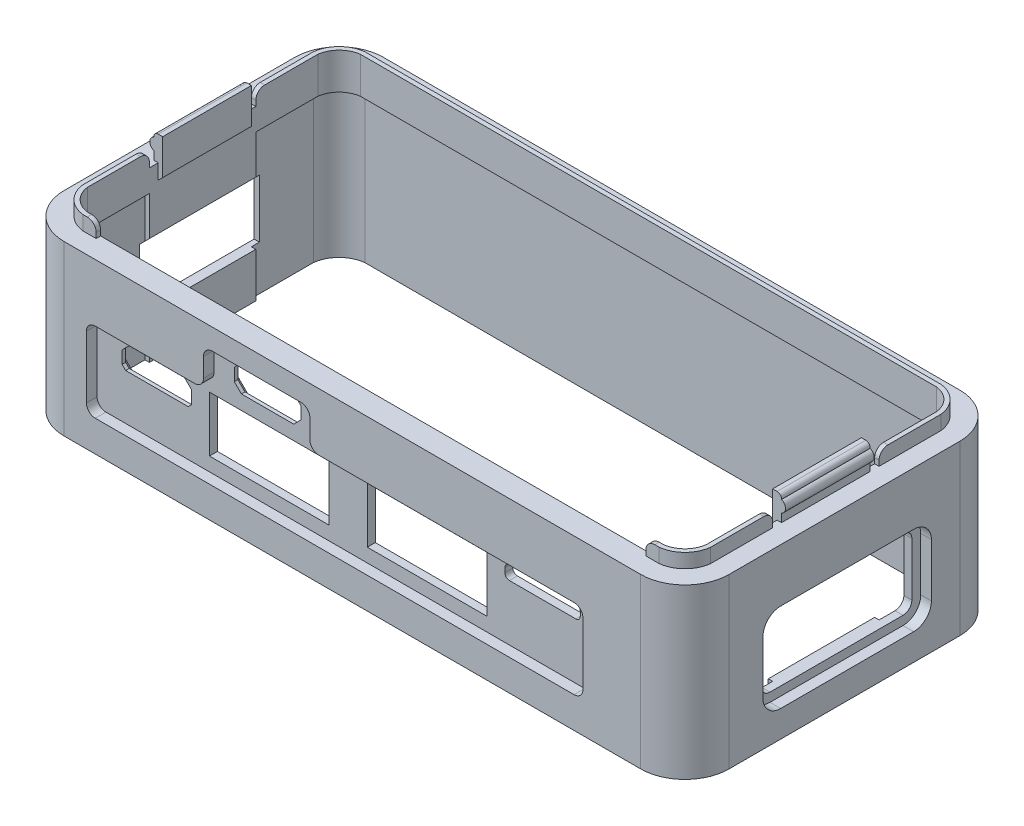
from build123d import *

# Parameters (mm, degrees)
EXTRUDE_2_DEPTH      = 19
EXTRUDE_4_DEPTH      = 1.6
CUT_EXTRUDE_START    = -19
CUT_EXTRUDE_2_DEPTH  = 19
SKETCH_17_W          = 13.5
SKETCH_17_H          = 6.25
SKETCH_17_W_2        = 7.85
SKETCH_17_H_2        = 2.62
SKETCH_17_W_3        = 7.5
CUT_EXTRUDE_4_DEPTH  = 2.62
CUT_EXTRUDE_5_REACH  = 81.833
SKETCH_18_W          = 13.5
SKETCH_18_H          = 6.25
CUT_EXTRUDE_6_REACH  = 81.833
SKETCH_19_W          = 17
SKETCH_19_H          = 8
CHAMFER_1_SIZE       = 0.4
CHAMFER_2_SIZE       = 0.8
SKETCH_21_W          = 56
SKETCH_21_H          = 9
CUT_EXTRUDE_8_DEPTH  = 1.2
SKETCH_22_W          = 12
SKETCH_22_H          = 4.148134673
CUT_EXTRUDE_9_DEPTH  = 1.2
SKETCH_23_W          = 19
SKETCH_23_H          = 10
CUT_EXTRUDE_10_DEPTH = 1.5
FILLET_2_R           = 1
CUT_EXTRUDE_11_DEPTH = 1.2
SKETCH_25_W          = 62
SKETCH_25_H          = 0.5
CUT_EXTRUDE_12_DEPTH = 1.6
FILLET_3_R           = 1
SKETCH_26_W          = 0.5
SKETCH_26_H          = 10
EXTRUDE_5_DEPTH      = 1.2
SKETCH_27_R          = 0.7
EXTRUDE_6_DEPTH      = 10
SKETCH_28_W          = 0.5
SKETCH_28_H          = 1
CUT_EXTRUDE_13_DEPTH = 1.6
FILLET_4_R           = 1
SKETCH_29_W          = 10
SKETCH_29_H          = 5
EXTRUDE_7_DEPTH      = 0.5
SKETCH_30_W          = 10
SKETCH_30_H          = 5
EXTRUDE_8_DEPTH      = 0.5
FILLET_5_R           = 0.5
CHAMFER_3_SIZE       = 1
CUT_EXTRUDE_14_REACH = 59.407
SKETCH_32_W          = 8.5
SKETCH_32_H          = 1.5
FILLET_6_R           = 0.5
CUT_EXTRUDE_18_DEPTH = 16.5
CHAMFER_5_SIZE       = 0.5
CHAMFER_6_SIZE       = 0.8


with BuildPart() as part:
    # case 2 → 凸台-拉伸2 (new body)
    with BuildSketch(Plane(origin=(0, 0, 0), x_dir=(1, 0, 0), z_dir=(0, 1, 0))):
        with BuildLine():
            Line((-34.042196447, 18), (30.957803553, 18))
            ThreePointArc((30.957803553, 18), (34.493337459, 16.535533906), (35.957803553, 13))
            Line((35.957803553, 13), (35.957803553, -13))
            ThreePointArc((35.957803553, -13), (34.493337459, -16.535533906), (30.957803553, -18))
            Line((30.957803553, -18), (-34.042196447, -18))
            ThreePointArc((-34.042196447, -18), (-37.577730353, -16.535533906), (-39.042196447, -13))
            Line((-39.042196447, -13), (-39.042196447, 13))
            ThreePointArc((-39.042196447, 13), (-37.577730353, 16.535533906), (-34.042196447, 18))
        make_face()
    extrude(amount=EXTRUDE_2_DEPTH)

    # 草图3 → 凸台-拉伸4 (add)
    with BuildSketch(Plane(origin=(0, 19, 0), x_dir=(1, 0, 0), z_dir=(0, 1, 0))):
        with BuildLine():
            Line((-36.942196447, 13), (-36.942196447, -13))
            ThreePointArc((-36.942196447, -13), (-35.997398295, -14.955201848), (-34.042196447, -15.9))
            Line((-34.042196447, -15.9), (30.957803553, -15.9))
            ThreePointArc((30.957803553, -15.9), (32.913005401, -14.955201848), (33.857803553, -13))
            Line((33.857803553, -13), (33.857803553, 13))
            ThreePointArc((33.857803553, 13), (32.913005401, 14.955201848), (30.957803553, 15.9))
            Line((30.957803553, 15.9), (-34.042196447, 15.9))
            ThreePointArc((-34.042196447, 15.9), (-35.997398295, 14.955201848), (-36.942196447, 13))
        make_face()
        with BuildLine():
            Line((-34.042196447, -15.4), (30.957803553, -15.4))
            ThreePointArc((30.957803553, -15.4), (32.562900965, -14.605097413), (33.357803553, -13))
            Line((33.357803553, -13), (33.357803553, 13))
            ThreePointArc((33.357803553, 13), (32.562900965, 14.605097413), (30.957803553, 15.4))
            Line((30.957803553, 15.4), (-34.042196447, 15.4))
            ThreePointArc((-34.042196447, 15.4), (-35.64729386, 14.605097413), (-36.442196447, 13))
            Line((-36.442196447, 13), (-36.442196447, -13))
            ThreePointArc((-36.442196447, -13), (-35.64729386, -14.605097413), (-34.042196447, -15.4))
        make_face(mode=Mode.SUBTRACT)
    extrude(amount=EXTRUDE_4_DEPTH)

    # 草图14 → 切除-拉伸2 (cut)
    with BuildSketch(Plane(origin=(0, 19, 0), x_dir=(1, 0, 0), z_dir=(0, 1, 0)).offset(CUT_EXTRUDE_START)):
        with BuildLine():
            Line((-34.042196447, -15.4), (30.957803553, -15.4))
            ThreePointArc((30.957803553, -15.4), (32.562900965, -14.605097413), (33.357803553, -13))
            Line((33.357803553, -13), (33.357803553, 13))
            ThreePointArc((33.357803553, 13), (32.562900965, 14.605097413), (30.957803553, 15.4))
            Line((30.957803553, 15.4), (-34.042196447, 15.4))
            ThreePointArc((-34.042196447, 15.4), (-35.64729386, 14.605097413), (-36.442196447, 13))
            Line((-36.442196447, 13), (-36.442196447, -13))
            ThreePointArc((-36.442196447, -13), (-35.64729386, -14.605097413), (-34.042196447, -15.4))
        make_face()
    extrude(amount=CUT_EXTRUDE_2_DEPTH, mode=Mode.SUBTRACT)

    # 草图17 → 切除-拉伸4 (cut)
    with BuildSketch(Plane.XY.offset(18)):
        with Locations((5.685908513, 8.169304758)):
            Rectangle(SKETCH_17_W, SKETCH_17_H)
        with Locations((-12.114091487, 8.169304758)):
            Rectangle(SKETCH_17_W, SKETCH_17_H)
        with Locations((-24.789091487, 9.984304758)):
            Rectangle(SKETCH_17_W_2, SKETCH_17_H_2)
        with Locations((-12.314091487, 14.224304758)):
            Rectangle(SKETCH_17_W_3, SKETCH_17_H_2)
    extrude(amount=-CUT_EXTRUDE_4_DEPTH, mode=Mode.SUBTRACT)

    # 草图18 → 切除-拉伸5 (cut, up to next)
    with BuildSketch(Plane.ZY.offset(39.042196447), mode=Mode.PRIVATE) as cut_extrude_5_sk1:
        with Locations((-0.163773099, 8.169304758)):
            Rectangle(SKETCH_18_W, SKETCH_18_H)
    cut_extrude_5_tool1 = extrude(cut_extrude_5_sk1.sketch, amount=-CUT_EXTRUDE_5_REACH, mode=Mode.PRIVATE) & part.part
    add(cut_extrude_5_tool1.solids().sort_by_distance((-39.042196, 8.169305, -0.163773))[0], mode=Mode.SUBTRACT)

    # 草图19 → 切除-拉伸6 (cut, up to next)
    with BuildSketch(Plane(origin=(35.957803553, 0, 0), x_dir=(0, 0, -1), z_dir=(1, 0, 0)), mode=Mode.PRIVATE) as cut_extrude_6_sk1:
        with Locations((0.3, 8)):
            Rectangle(SKETCH_19_W, SKETCH_19_H)
    cut_extrude_6_tool1 = extrude(cut_extrude_6_sk1.sketch, amount=-CUT_EXTRUDE_6_REACH, mode=Mode.PRIVATE) & part.part
    add(cut_extrude_6_tool1.solids().sort_by_distance((35.957804, 8, -0.3))[0], mode=Mode.SUBTRACT)

    # 倒角1
    chamfer_1_edges = [part.edges().sort_by_distance(p)[0] for p in [
        (-20.864091487, 8.674304758, 16.7),
        (-28.714091487, 8.674304758, 16.7),
        (-8.564091487, 15.534304758, 16.7),
        (-16.064091487, 15.534304758, 16.7),
    ]]
    chamfer(chamfer_1_edges, length=CHAMFER_1_SIZE)

    # 倒角2
    chamfer_2_edges = [part.edges().sort_by_distance(p)[0] for p in [
        (-20.864091487, 11.294304758, 16.7),
        (-28.714091487, 11.294304758, 16.7),
        (-8.564091487, 12.914304758, 16.7),
        (-16.064091487, 12.914304758, 16.7),
    ]]
    chamfer(chamfer_2_edges, length=CHAMFER_2_SIZE)

    # 草图21 → 切除-拉伸8 (cut)
    with BuildSketch(Plane.XY.offset(18)):
        with Locations((-3.542196447, 8)):
            Rectangle(SKETCH_21_W, SKETCH_21_H)
    extrude(amount=-CUT_EXTRUDE_8_DEPTH, mode=Mode.SUBTRACT)

    # 草图22 → 切除-拉伸9 (cut)
    with BuildSketch(Plane.XY.offset(18)):
        with Locations((-12.342196447, 14.574067337)):
            Rectangle(SKETCH_22_W, SKETCH_22_H)
    extrude(amount=-CUT_EXTRUDE_9_DEPTH, mode=Mode.SUBTRACT)

    # 草图23 → 切除-拉伸10 (cut)
    with BuildSketch(Plane.ZY.offset(39.042196447)):
        with Locations((-0.163773099, 8.156152974)):
            Rectangle(SKETCH_23_W, SKETCH_23_H)
    extrude(amount=-CUT_EXTRUDE_10_DEPTH, mode=Mode.SUBTRACT)

    # 圆角2
    fillet_2_edges = [part.edges().sort_by_distance(p)[0] for p in [
        (34.657803553, 4, 8.2),
        (34.657803553, 12, 8.2),
        (34.657803553, 12, -8.8),
        (34.657803553, 4, -8.8),
        (24.457803553, 12.5, 17.4),
        (24.457803553, 3.5, 17.4),
        (-31.542196447, 3.5, 17.4),
        (-31.542196447, 12.5, 17.4),
        (-6.342196447, 16.648134673, 17.4),
        (-6.342196447, 12.5, 17.4),
        (-18.342196447, 12.5, 17.4),
        (-18.342196447, 16.648134673, 17.4),
        (-38.292196447, 3.156152974, -9.663773099),
        (-38.292196447, 13.156152974, -9.663773099),
        (-38.292196447, 13.156152974, 9.336226901),
        (-38.292196447, 3.156152974, 9.336226901),
    ]]
    fillet(fillet_2_edges, radius=FILLET_2_R)

    # 草图24 → 切除-拉伸11 (cut)
    with BuildSketch(Plane(origin=(35.957803553, 0, 0), x_dir=(0, 0, -1), z_dir=(1, 0, 0))):
        with BuildLine():
            Line((-9.2, 11), (-9.2, 5))
            ThreePointArc((-9.2, 5), (-8.614213562, 3.585786438), (-7.2, 3))
            Line((-7.2, 3), (7.8, 3))
            ThreePointArc((7.8, 3), (9.214213562, 3.585786438), (9.8, 5))
            Line((9.8, 5), (9.8, 11))
            ThreePointArc((9.8, 11), (9.214213562, 12.414213562), (7.8, 13))
            Line((7.8, 13), (-7.2, 13))
            ThreePointArc((-7.2, 13), (-8.614213562, 12.414213562), (-9.2, 11))
        make_face()
    extrude(amount=-CUT_EXTRUDE_11_DEPTH, mode=Mode.SUBTRACT)

    # 草图25 → 切除-拉伸12 (cut)
    with BuildSketch(Plane(origin=(0, 20.6, 0), x_dir=(1, 0, 0), z_dir=(0, 1, 0))):
        with Locations((-1.542196447, -15.65)):
            Rectangle(SKETCH_25_W, SKETCH_25_H)
    extrude(amount=-CUT_EXTRUDE_12_DEPTH, mode=Mode.SUBTRACT)

    # 圆角3
    fillet_3_edges = [part.edges().sort_by_distance(p)[0] for p in [
        (-32.542196447, 20.6, 15.65),
        (29.457803553, 20.6, 15.65),
    ]]
    fillet(fillet_3_edges, radius=FILLET_3_R)

    # 草图26 → 凸台-拉伸5 (add)
    with BuildSketch(Plane(origin=(0, 20.6, 0), x_dir=(1, 0, 0), z_dir=(0, 1, 0))):
        with Locations((33.607803553, 0)):
            Rectangle(SKETCH_26_W, SKETCH_26_H)
        with Locations((-36.692196447, 0)):
            Rectangle(SKETCH_26_W, SKETCH_26_H)
    extrude(amount=EXTRUDE_5_DEPTH)

    # 草图27 → 凸台-拉伸6 (add)
    with BuildSketch(Plane.XY.offset(5)):
        with Locations((33.607803553, 20.6)):
            Circle(SKETCH_27_R)
        with Locations((-36.692196447, 20.6)):
            Circle(SKETCH_27_R)
    extrude(amount=-EXTRUDE_6_DEPTH)

    # 草图28 → 切除-拉伸13 (cut)
    with BuildSketch(Plane(origin=(0, 20.6, 0), x_dir=(1, 0, 0), z_dir=(0, 1, 0))):
        with Locations((33.607803553, -5.5)):
            Rectangle(SKETCH_28_W, SKETCH_28_H)
        with Locations((33.607803553, 5.5)):
            Rectangle(SKETCH_28_W, SKETCH_28_H)
        with Locations((-36.692196447, -5.5)):
            Rectangle(SKETCH_28_W, SKETCH_28_H)
        with Locations((-36.692196447, 5.5)):
            Rectangle(SKETCH_28_W, SKETCH_28_H)
    extrude(amount=-CUT_EXTRUDE_13_DEPTH, mode=Mode.SUBTRACT)

    # 圆角4
    fillet_4_edges = [part.edges().sort_by_distance(p)[0] for p in [
        (33.607803553, 20.6, -6),
        (-36.692196447, 20.6, 6),
        (-36.692196447, 20.6, -6),
        (33.607803553, 20.6, 6),
    ]]
    fillet(fillet_4_edges, radius=FILLET_4_R)

    # 草图29 → 凸台-拉伸7 (add)
    with BuildSketch(Plane.ZY.offset(-33.357803553)):
        with Locations((0, 19.3)):
            Rectangle(SKETCH_29_W, SKETCH_29_H)
    extrude(amount=EXTRUDE_7_DEPTH)

    # 草图30 → 凸台-拉伸8 (add)
    with BuildSketch(Plane(origin=(-36.442196447, 0, 0), x_dir=(0, 0, -1), z_dir=(1, 0, 0))):
        with Locations((0, 19.3)):
            Rectangle(SKETCH_30_W, SKETCH_30_H)
    extrude(amount=EXTRUDE_8_DEPTH)

    # 圆角5
    fillet_5_edges = [part.edges().sort_by_distance(p)[0] for p in [
        (33.857803553, 21.8, 0),
        (-36.942196447, 21.8, 0),
    ]]
    fillet(fillet_5_edges, radius=FILLET_5_R)

    # 倒角3
    # the kernel refuses this chamfer: 1 mm, written as the material it takes off along each edge
    with BuildSketch(Plane(origin=(-35.942196447, 16.8, -7.571682988), x_dir=(-0.9996219169112968, -0.02749587661058555, 0), z_dir=(0, 0, 1))) as chamfer_3_piece_1_section:
        Polygon((CHAMFER_3_SIZE * 0.999621916911, -CHAMFER_3_SIZE * 0.0274958766106), (-CHAMFER_3_SIZE * 0.0274958766106, -CHAMFER_3_SIZE * 0.999621916911), (0, 0), align=None)
    chamfer_3_piece_1 = extrude(amount=15.143365976, mode=Mode.PRIVATE)
    chamfer_3_piece_1 = split(chamfer_3_piece_1, bisect_by=Plane(origin=(-36.442196447, 17.193401084, 0), z_dir=(1, 0, 0)), keep=Keep.TOP, mode=Mode.PRIVATE)
    add(chamfer_3_piece_1, mode=Mode.SUBTRACT)
    with BuildSketch(Plane(origin=(32.857803553, 16.8, 7.571682988), x_dir=(-0.0274958766105891, 0.9996219169112968, 0), z_dir=(0, 0, -1))) as chamfer_3_piece_2_section:
        Polygon((CHAMFER_3_SIZE * 0.999621916911, CHAMFER_3_SIZE * 0.0274958766106), (-CHAMFER_3_SIZE * 0.0274958766106, CHAMFER_3_SIZE * 0.999621916911), (0, 0), align=None)
    chamfer_3_piece_2 = extrude(amount=15.143365976, mode=Mode.PRIVATE)
    chamfer_3_piece_2 = split(chamfer_3_piece_2, bisect_by=Plane(origin=(33.357803553, 17.193401084, 0), z_dir=(-1, 0, 0)), keep=Keep.TOP, mode=Mode.PRIVATE)
    add(chamfer_3_piece_2, mode=Mode.SUBTRACT)

    # 草图32 → 切除-拉伸14 (cut, up to next)
    with BuildSketch(Plane.XY.offset(18), mode=Mode.PRIVATE) as cut_extrude_14_sk1:
        with Locations((18.707803553, 10.55)):
            Rectangle(SKETCH_32_W, SKETCH_32_H)
    cut_extrude_14_tool1 = extrude(cut_extrude_14_sk1.sketch, amount=-CUT_EXTRUDE_14_REACH, mode=Mode.PRIVATE) & part.part
    add(cut_extrude_14_tool1.solids().sort_by_distance((18.707804, 10.55, 18))[0], mode=Mode.SUBTRACT)

    # 圆角6
    fillet_6_edges = [part.edges().sort_by_distance(p)[0] for p in [
        (14.457803553, 11.3, 16.1),
        (14.457803553, 9.8, 16.1),
        (22.957803553, 9.8, 16.1),
        (22.957803553, 11.3, 16.1),
    ]]
    fillet(fillet_6_edges, radius=FILLET_6_R)

    # 草图36 → 切除-拉伸18 (cut)
    with BuildSketch(Plane(origin=(0, 0, 0), x_dir=(1, 0, 0), z_dir=(0, 1, 0))):
        with BuildLine():
            Line((-32.542196447, -15.9), (29.457803553, -15.9))
            Line((29.457803553, -15.9), (30.457803553, -15.9))
            Line((30.457803553, -15.9), (30.957803553, -15.9))
            ThreePointArc((30.957803553, -15.9), (32.913005401, -14.955201848), (33.857803553, -13))
            Line((33.857803553, -13), (33.857803553, -7))
            Line((33.857803553, -7), (33.857803553, -6))
            Line((33.857803553, -6), (33.357803553, -6))
            Line((33.357803553, -6), (33.357803553, -7))
            Line((33.357803553, -7), (33.357803553, -13))
            ThreePointArc((33.357803553, -13), (32.562900965, -14.605097413), (30.957803553, -15.4))
            Line((30.957803553, -15.4), (30.457803553, -15.4))
            Line((30.457803553, -15.4), (29.457803553, -15.4))
            Line((29.457803553, -15.4), (-32.542196447, -15.4))
            Line((-32.542196447, -15.4), (-33.542196447, -15.4))
            Line((-33.542196447, -15.4), (-34.042196447, -15.4))
            ThreePointArc((-34.042196447, -15.4), (-35.64729386, -14.605097413), (-36.442196447, -13))
            Line((-36.442196447, -13), (-36.442196447, -7))
            Line((-36.442196447, -7), (-36.442196447, -6))
            Line((-36.442196447, -6), (-36.942196447, -6))
            Line((-36.942196447, -6), (-36.942196447, -7))
            Line((-36.942196447, -7), (-36.942196447, -13))
            ThreePointArc((-36.942196447, -13), (-35.997398295, -14.955201848), (-34.042196447, -15.9))
            Line((-34.042196447, -15.9), (-33.542196447, -15.9))
            Line((-33.542196447, -15.9), (-32.542196447, -15.9))
        make_face()
        with BuildLine():
            Line((33.857803553, 6), (33.857803553, 7))
            Line((33.857803553, 7), (33.857803553, 13))
            ThreePointArc((33.857803553, 13), (32.913005401, 14.955201848), (30.957803553, 15.9))
            Line((30.957803553, 15.9), (-34.042196447, 15.9))
            ThreePointArc((-34.042196447, 15.9), (-35.997398295, 14.955201848), (-36.942196447, 13))
            Line((-36.942196447, 13), (-36.942196447, 7))
            Line((-36.942196447, 7), (-36.942196447, 6))
            Line((-36.942196447, 6), (-36.442196447, 6))
            Line((-36.442196447, 6), (-36.442196447, 7))
            Line((-36.442196447, 7), (-36.442196447, 13))
            ThreePointArc((-36.442196447, 13), (-35.64729386, 14.605097413), (-34.042196447, 15.4))
            Line((-34.042196447, 15.4), (30.957803553, 15.4))
            ThreePointArc((30.957803553, 15.4), (32.562900965, 14.605097413), (33.357803553, 13))
            Line((33.357803553, 13), (33.357803553, 7))
            Line((33.357803553, 7), (33.357803553, 6))
            Line((33.357803553, 6), (33.857803553, 6))
        make_face()
    extrude(amount=CUT_EXTRUDE_18_DEPTH, mode=Mode.SUBTRACT)

    # 倒角5
    chamfer_5_edges = [part.edges().sort_by_distance(p)[0] for p in [
        (-12.314091487, 15.534304758, 15.9),
        (-15.864091487, 15.334304758, 15.9),
        (-16.064091487, 14.424304758, 15.9),
        (-15.664091487, 13.314304758, 15.9),
        (-12.314091487, 12.914304758, 15.9),
        (-8.964091487, 13.314304758, 15.9),
        (-8.564091487, 14.424304758, 15.9),
        (-8.764091487, 15.334304758, 15.9),
        (-28.714091487, 9.784304758, 15.9),
        (-28.514091487, 8.874304758, 15.9),
        (-24.789091487, 8.674304758, 15.9),
        (-21.064091487, 8.874304758, 15.9),
        (-20.864091487, 9.784304758, 15.9),
        (-21.264091487, 10.894304758, 15.9),
        (-24.789091487, 11.294304758, 15.9),
        (-28.314091487, 10.894304758, 15.9),
    ]]
    chamfer(chamfer_5_edges, length=CHAMFER_5_SIZE)

    # 倒角6
    chamfer_6_edges = [part.edges().sort_by_distance(p)[0] for p in [
        (-36.442196447, 11.294304758, 0),
    ]]
    chamfer(chamfer_6_edges, length=CHAMFER_6_SIZE)


solid = part.part
